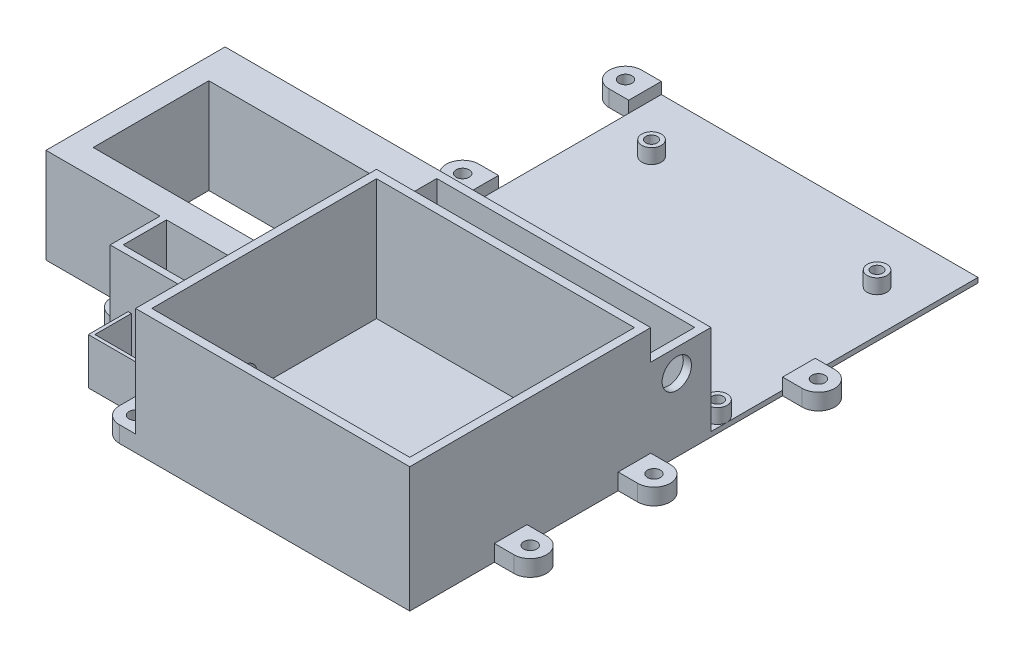
from build123d import *

# Parameters (mm, degrees)
SKETCH1_W             = 79.2
SKETCH1_H             = 69
BOSS_EXTRUDE1_DEPTH   = 1.2
SKETCH1_W_2           = 23.5
SKETCH1_H_2           = 11.2
BOSS_EXTRUDE1_2_DEPTH = 1.2
SKETCH1_W_3           = 28
SKETCH1_H_3           = 13.3
BOSS_EXTRUDE1_3_DEPTH = 1.2
SKETCH1_3_W           = 79.2
SKETCH1_3_H           = 69
BOSS_EXTRUDE2_DEPTH   = 38.4
SKETCH1_4_R           = 2
BOSS_EXTRUDE3_DEPTH   = 5
SKETCH2_R             = 3
SKETCH2_R_2           = 4
CUT_EXTRUDE1_DEPTH    = 5
SKETCH1_5_W           = 52
SKETCH1_5_H           = 35.5
BOSS_EXTRUDE4_DEPTH   = 29.2
SKETCH1_6_W           = 79.2
SKETCH1_6_H           = 16
BOSS_EXTRUDE5_DEPTH   = 1.2
SKETCH1_9_W           = 97.25
SKETCH1_9_H           = 82
SKETCH1_9_R           = 1.75
BOSS_EXTRUDE9_DEPTH   = 1.5
SKETCH1_10_R          = 3
SKETCH1_10_R_2        = 1.75
BOSS_EXTRUDE10_DEPTH  = 6
SKETCH1_11_W          = 52
SKETCH1_11_H          = 35.5
BOSS_EXTRUDE11_DEPTH  = 19
SKETCH3_R             = 4.5
CUT_EXTRUDE2_DEPTH    = 10
BOSS_EXTRUDE12_DEPTH  = 29.2
BOSS_EXTRUDE13_DEPTH  = 14.2


with BuildPart() as part:
    # Sketch1 → Boss-Extrude1 (new body)
    with BuildSketch(Plane(origin=(0, 0, 0), x_dir=(1, 0, 0), z_dir=(0, 1, 0))):
        Rectangle(SKETCH1_W, SKETCH1_H)
    extrude(amount=BOSS_EXTRUDE1_DEPTH)

    # Sketch1<3> → Boss-Extrude2 (add)
    with BuildSketch(Plane(origin=(0, 0, 0), x_dir=(1, 0, 0), z_dir=(0, 1, 0))):
        Polygon((-42.1, -27), (-42.1, -37), (42.1, -37), (42.1, -11), (42.1, -1), (42.1, 27), (42.1, 37), (39.6, 37), (-39.6, 37), (-42.1, 37), (-42.1, 0.5), (-42.1, -12.8), (-42.1, -14.8), (-42.1, -26), align=None)
        Rectangle(SKETCH1_3_W, SKETCH1_3_H, mode=Mode.SUBTRACT)
    extrude(amount=BOSS_EXTRUDE2_DEPTH)

    # Sketch1<4> → Boss-Extrude3 (add)
    # profile 1 of 8: a face of its own
    with BuildSketch(Plane(origin=(0, 0, 0), x_dir=(1, 0, 0), z_dir=(0, 1, 0))):
        with BuildLine():
            Line((-47.1, -37), (-42.1, -37))
            Line((-42.1, -37), (-42.1, -27))
            Line((-42.1, -27), (-52.1, -27))
            Line((-52.1, -27), (-52.1, -32))
            ThreePointArc((-52.1, -32), (-50.635533906, -35.535533906), (-47.1, -37))
        make_face()
        with Locations((-47.1, -32)):
            Circle(SKETCH1_4_R, mode=Mode.SUBTRACT)
    # profile 2 of 8: a face of its own
    with BuildSketch(Plane(origin=(0, 0, 0), x_dir=(1, 0, 0), z_dir=(0, 1, 0))):
        with BuildLine():
            Line((42.1, -1), (42.1, -11))
            Line((42.1, -11), (48.1, -11))
            ThreePointArc((48.1, -11), (53.1, -6), (48.1, -1))
            Line((48.1, -1), (42.1, -1))
        make_face()
        with Locations((48.1, -6)):
            Circle(SKETCH1_4_R, mode=Mode.SUBTRACT)
    # profile 3 of 8: a face of its own
    with BuildSketch(Plane(origin=(0, 0, 0), x_dir=(1, 0, 0), z_dir=(0, 1, 0))):
        with BuildLine():
            Line((42.1, 37), (42.1, 27))
            Line((42.1, 27), (48.1, 27))
            ThreePointArc((48.1, 27), (53.1, 32), (48.1, 37))
            Line((48.1, 37), (42.1, 37))
        make_face()
        with Locations((48.1, 32)):
            Circle(SKETCH1_4_R, mode=Mode.SUBTRACT)
    # profile 4 of 8: a face of its own
    with BuildSketch(Plane(origin=(0, 0, 0), x_dir=(1, 0, 0), z_dir=(0, 1, 0))):
        with BuildLine():
            Line((-72.1, -9.5), (-72.1, 0.5))
            Line((-72.1, 0.5), (-82.1, 0.5))
            Line((-82.1, 0.5), (-82.1, -4.5))
            ThreePointArc((-82.1, -4.5), (-80.635533906, -8.035533906), (-77.1, -9.5))
            Line((-77.1, -9.5), (-72.1, -9.5))
        make_face()
        with Locations((-77.1, -4.5)):
            Circle(SKETCH1_4_R, mode=Mode.SUBTRACT)
    # profile 5 of 8: a face of its own
    with BuildSketch(Plane(origin=(0, 0, 0), x_dir=(1, 0, 0), z_dir=(0, 1, 0))):
        with BuildLine():
            Line((42.1, 87.5), (42.1, 77.5))
            Line((42.1, 77.5), (48.1, 77.5))
            ThreePointArc((48.1, 77.5), (53.1, 82.5), (48.1, 87.5))
            Line((48.1, 87.5), (42.1, 87.5))
        make_face()
        with Locations((48.1, 82.5)):
            Circle(SKETCH1_4_R, mode=Mode.SUBTRACT)
    # profile 6 of 8: a face of its own
    with BuildSketch(Plane(origin=(0, 0, 0), x_dir=(1, 0, 0), z_dir=(0, 1, 0))):
        with BuildLine():
            Line((-107.1, 55.5), (-97.1, 55.5))
            Line((-97.1, 55.5), (-97.1, 60.5))
            ThreePointArc((-97.1, 60.5), (-102.1, 65.5), (-107.1, 60.5))
            Line((-107.1, 60.5), (-107.1, 55.5))
        make_face()
        with Locations((-102.1, 60.5)):
            Circle(SKETCH1_4_R, mode=Mode.SUBTRACT)
    # profile 7 of 8: a face of its own
    with BuildSketch(Plane(origin=(0, 0, 0), x_dir=(1, 0, 0), z_dir=(0, 1, 0))):
        with BuildLine():
            Line((-61.15, 77.5), (-55.15, 77.5))
            Line((-55.15, 77.5), (-55.15, 87.5))
            Line((-55.15, 87.5), (-61.15, 87.5))
            ThreePointArc((-61.15, 87.5), (-66.15, 82.5), (-61.15, 77.5))
        make_face()
        with Locations((-61.15, 82.5)):
            Circle(SKETCH1_4_R, mode=Mode.SUBTRACT)
    # profile 8 of 8: a face of its own
    with BuildSketch(Plane(origin=(0, 0, 0), x_dir=(1, 0, 0), z_dir=(0, 1, 0))):
        with BuildLine():
            Line((-55.15, 127.5), (-55.15, 137.5))
            Line((-55.15, 137.5), (-61.15, 137.5))
            ThreePointArc((-61.15, 137.5), (-66.15, 132.5), (-61.15, 127.5))
            Line((-61.15, 127.5), (-55.15, 127.5))
        make_face()
        with Locations((-61.15, 132.5)):
            Circle(SKETCH1_4_R, mode=Mode.SUBTRACT)
    extrude(amount=BOSS_EXTRUDE3_DEPTH)


with BuildPart() as body_2:
    # Sketch1 → Boss-Extrude1 2 (new body)
    with BuildSketch(Plane(origin=(0, 0, 0), x_dir=(1, 0, 0), z_dir=(0, 1, 0))):
        with Locations((-53.85, -20.4)):
            Rectangle(SKETCH1_W_2, SKETCH1_H_2)
    extrude(amount=BOSS_EXTRUDE1_2_DEPTH)



with BuildPart() as body_3:
    # Sketch1 → Boss-Extrude1 3 (new body)
    with BuildSketch(Plane(origin=(0, 0, 0), x_dir=(1, 0, 0), z_dir=(0, 1, 0))):
        with Locations((-56.1, -6.15)):
            Rectangle(SKETCH1_W_3, SKETCH1_H_3)
    extrude(amount=BOSS_EXTRUDE1_3_DEPTH)


with BuildPart() as boss_extrude3_piece_1:
    # of the separate pieces the step leaves, piece 1, a body of its own (boss_extrude3_pieces)
    add(part.part.solids().sort_by_distance((42.1, 0, 37))[0])

    # Sketch2 → Cut-Extrude1 (cut)
    with BuildSketch(Plane.ZY.offset(42.1)):
        with Locations((31, 19.65)):
            Circle(SKETCH2_R)
        with Locations((6.15, 5.2)):
            Circle(SKETCH2_R_2)
        with Locations((20.4, 4.2)):
            Circle(SKETCH2_R)
    extrude(amount=-CUT_EXTRUDE1_DEPTH, mode=Mode.SUBTRACT)

    # Sketch1<5> → Boss-Extrude4 (add)
    with BuildSketch(Plane(origin=(0, 0, 0), x_dir=(1, 0, 0), z_dir=(0, 1, 0))):
        Polygon((39.6, 37), (42.1, 37), (42.1, 55.5), (-42.1, 55.5), (-55.15, 55.5), (-97.1, 55.5), (-107.1, 55.5), (-107.1, 0.5), (-82.1, 0.5), (-72.1, 0.5), (-70.1, 0.5), (-42.1, 0.5), (-42.1, 37), (-39.6, 37), (-39.6, 53), (39.6, 53), align=None)
        with Locations((-74.6, 26.25)):
            Rectangle(SKETCH1_5_W, SKETCH1_5_H, mode=Mode.SUBTRACT)
    extrude(amount=BOSS_EXTRUDE4_DEPTH)

    # Sketch1<6> → Boss-Extrude5 (add)
    with BuildSketch(Plane(origin=(0, 0, 0), x_dir=(1, 0, 0), z_dir=(0, 1, 0))):
        with Locations((0, 45)):
            Rectangle(SKETCH1_6_W, SKETCH1_6_H)
    extrude(amount=BOSS_EXTRUDE5_DEPTH)

    # Sketch1<9> → Boss-Extrude9 (add)
    with BuildSketch(Plane(origin=(0, 0, 0), x_dir=(1, 0, 0), z_dir=(0, 1, 0))):
        with Locations((-6.525, 96.5)):
            Rectangle(SKETCH1_9_W, SKETCH1_9_H)
        with Locations((39.1, 60.5)):
            Circle(SKETCH1_9_R, mode=Mode.SUBTRACT)
        with Locations((-52.15, 60.5)):
            Circle(SKETCH1_9_R, mode=Mode.SUBTRACT)
        with Locations((-40.15, 119.5)):
            Circle(SKETCH1_9_R, mode=Mode.SUBTRACT)
        with Locations((29.1, 119.5)):
            Circle(SKETCH1_9_R, mode=Mode.SUBTRACT)
    extrude(amount=BOSS_EXTRUDE9_DEPTH)

    # Sketch1<10> → Boss-Extrude10 (add)
    # profile 1 of 4: a face of its own
    with BuildSketch(Plane(origin=(0, 0, 0), x_dir=(1, 0, 0), z_dir=(0, 1, 0))):
        with Locations((39.1, 60.5)):
            Circle(SKETCH1_10_R)
        with Locations((39.1, 60.5)):
            Circle(SKETCH1_10_R_2, mode=Mode.SUBTRACT)
    # profile 2 of 4: a face of its own
    with BuildSketch(Plane(origin=(0, 0, 0), x_dir=(1, 0, 0), z_dir=(0, 1, 0))):
        with Locations((-52.15, 60.5)):
            Circle(SKETCH1_10_R)
        with Locations((-52.15, 60.5)):
            Circle(SKETCH1_10_R_2, mode=Mode.SUBTRACT)
    # profile 3 of 4: a face of its own
    with BuildSketch(Plane(origin=(0, 0, 0), x_dir=(1, 0, 0), z_dir=(0, 1, 0))):
        with Locations((-40.15, 119.5)):
            Circle(SKETCH1_10_R)
        with Locations((-40.15, 119.5)):
            Circle(SKETCH1_10_R_2, mode=Mode.SUBTRACT)
    # profile 4 of 4: a face of its own
    with BuildSketch(Plane(origin=(0, 0, 0), x_dir=(1, 0, 0), z_dir=(0, 1, 0))):
        with Locations((29.1, 119.5)):
            Circle(SKETCH1_10_R)
        with Locations((29.1, 119.5)):
            Circle(SKETCH1_10_R_2, mode=Mode.SUBTRACT)
    extrude(amount=BOSS_EXTRUDE10_DEPTH)

    # Sketch1<11> → Boss-Extrude11 (add)
    with BuildSketch(Plane(origin=(0, 0, 0), x_dir=(1, 0, 0), z_dir=(0, 1, 0))):
        Polygon((39.6, 37), (42.1, 37), (42.1, 55.5), (-42.1, 55.5), (-55.15, 55.5), (-97.1, 55.5), (-107.1, 55.5), (-107.1, 0.5), (-82.1, 0.5), (-72.1, 0.5), (-70.1, 0.5), (-42.1, 0.5), (-42.1, 37), (-39.6, 37), (-39.6, 53), (39.6, 53), align=None)
        with Locations((-74.6, 26.25)):
            Rectangle(SKETCH1_11_W, SKETCH1_11_H, mode=Mode.SUBTRACT)
    extrude(amount=BOSS_EXTRUDE11_DEPTH)

    # Sketch3 → Cut-Extrude2 (cut)
    with BuildSketch(Plane.ZY.offset(-39.6)):
        with Locations((-45, 22.2)):
            Circle(SKETCH3_R)
    extrude(amount=-CUT_EXTRUDE2_DEPTH, mode=Mode.SUBTRACT)


with BuildPart() as boss_extrude3_piece_2:
    # of the separate pieces the step leaves, piece 2, a body of its own (boss_extrude3_pieces)
    add(part.part.solids().sort_by_distance((42.1, 0, -87.5))[0])


with BuildPart() as boss_extrude3_piece_3:
    # of the separate pieces the step leaves, piece 3, a body of its own (boss_extrude3_pieces)
    add(part.part.solids().sort_by_distance((-61.15, 0, -77.5))[0])


with BuildPart() as boss_extrude3_piece_4:
    # of the separate pieces the step leaves, piece 4, a body of its own (boss_extrude3_pieces)
    add(part.part.solids().sort_by_distance((-61.15, 0, -127.5))[0])


with BuildPart() as boss_extrude3_piece_5:
    # of the separate pieces the step leaves, piece 5, a body of its own (boss_extrude3_pieces)
    add(part.part.solids().sort_by_distance((-72.1, 0, 9.5))[0])


with BuildPart() as boss_extrude3_piece_6:
    # of the separate pieces the step leaves, piece 6, a body of its own (boss_extrude3_pieces)
    add(part.part.solids().sort_by_distance((-107.1, 0, -60.5))[0])


with BuildPart() as body_2_1:
    add(body_2.part)

    add(body_3.part)  # Boss-Extrude12 merges body 3

    add(boss_extrude3_piece_1.part)  # Boss-Extrude12 merges Boss-Extrude3 piece 1

    add(boss_extrude3_piece_5.part)  # Boss-Extrude12 merges Boss-Extrude3 piece 5
    # Sketch1<12> → Boss-Extrude12 (add)
    with BuildSketch(Plane(origin=(0, 0, 0), x_dir=(1, 0, 0), z_dir=(0, 1, 0))):
        Polygon((-65.6, -14.8), (-42.1, -14.8), (-42.1, -12.8), (-70.1, -12.8), (-70.1, 0.5), (-72.1, 0.5), (-72.1, -9.5), (-72.1, -14.8), (-66.6, -14.8), align=None)
    extrude(amount=BOSS_EXTRUDE12_DEPTH)

    # Sketch1<13> → Boss-Extrude13 (add)
    with BuildSketch(Plane(origin=(0, 0, 0), x_dir=(1, 0, 0), z_dir=(0, 1, 0))):
        Polygon((-47.1, -27), (-42.1, -27), (-42.1, -26), (-65.6, -26), (-65.6, -14.8), (-66.6, -14.8), (-66.6, -27), (-52.1, -27), align=None)
    extrude(amount=BOSS_EXTRUDE13_DEPTH)


solid = Compound([boss_extrude3_piece_2.part, boss_extrude3_piece_3.part, boss_extrude3_piece_4.part, boss_extrude3_piece_6.part, body_2_1.part])
